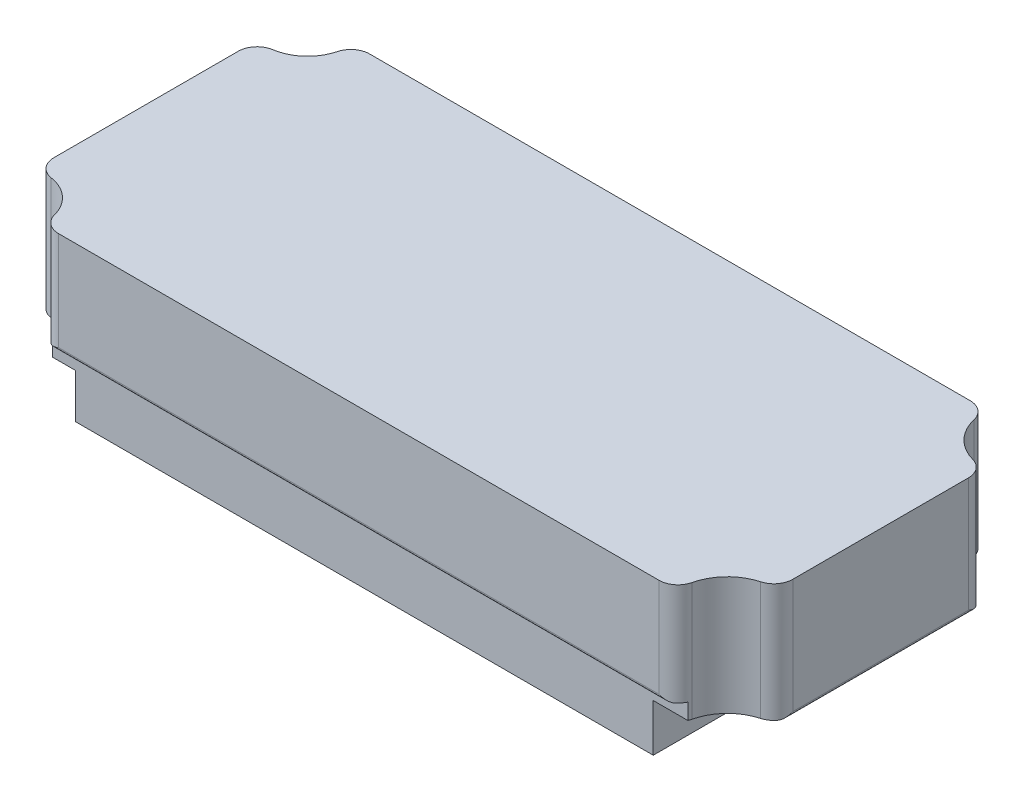
from build123d import *
from OCP.BRepAlgoAPI import BRepAlgoAPI_Cut
from OCP.TopTools import TopTools_ListOfShape

# Parameters (mm, degrees)
BOSS_EXTRUDE1_DEPTH     = 21.85
CUT_EXTRUDE1_DEPTH      = 48.4
CUT_EXTRUDE1_DEPTH_BACK = 48.4
CUT_EXTRUDE2_DEPTH      = 20.5
CUT_EXTRUDE2_DEPTH_BACK = 20.5


with BuildPart() as part:
    # Sketch1 → Boss-Extrude1 (new body)
    with BuildSketch(Plane(origin=(0, 0, 0), x_dir=(1, 0, 0), z_dir=(0, 1, 0))):
        with BuildLine():
            Line((-48.4, 12.151203914), (-48.4, -12.151203914))
            ThreePointArc((-48.4, -12.151203914), (-47.79906628, -13.773402604), (-46.286322418, -14.612602183))
            ThreePointArc((-46.286322418, -14.612602183), (-43.456956945, -15.955525197), (-41.833947517, -18.63406801))
            ThreePointArc((-41.833947517, -18.63406801), (-40.94758788, -19.979013629), (-39.423420787, -20.5))
            Line((-39.423420787, -20.5), (39.709565228, -20.5))
            ThreePointArc((39.709565228, -20.5), (41.256886583, -19.960870735), (42.134162778, -18.57694508))
            ThreePointArc((42.134162778, -18.57694508), (43.717900388, -15.664841516), (46.568112128, -13.972250299))
            ThreePointArc((46.568112128, -13.972250299), (47.889747358, -13.080993613), (48.4, -11.570794818))
            Line((48.4, -11.570794818), (48.4, 11.570794818))
            ThreePointArc((48.4, 11.570794818), (47.889747358, 13.080993613), (46.568112128, 13.972250299))
            ThreePointArc((46.568112128, 13.972250299), (43.717900388, 15.664841516), (42.134162778, 18.57694508))
            ThreePointArc((42.134162778, 18.57694508), (41.256886583, 19.960870735), (39.709565228, 20.5))
            Line((39.709565228, 20.5), (-39.423420787, 20.5))
            ThreePointArc((-39.423420787, 20.5), (-40.94758788, 19.979013629), (-41.833947517, 18.63406801))
            ThreePointArc((-41.833947517, 18.63406801), (-43.456956895, 15.955525241), (-46.286322286, 14.612602203))
            ThreePointArc((-46.286322286, 14.612602203), (-47.799066237, 13.773402654), (-48.4, 12.151203914))
        make_face()
    extrude(amount=BOSS_EXTRUDE1_DEPTH)

    # Sketch2 → Cut-Extrude1 (cut, two sides: drawn at the far end of the back side and taken through both)
    with BuildSketch(Plane(origin=(0, 0, 0), x_dir=(0, 0, -1), z_dir=(1, 0, 0)).offset(-CUT_EXTRUDE1_DEPTH_BACK)):
        with BuildLine():
            Line((-20.5, 8.85), (-20.5, 0))
            Line((-20.5, 0), (-19, 0))
            Line((-19, 0), (-19, 8.35))
            Line((-19, 8.35), (-20, 8.35))
            ThreePointArc((-20, 8.35), (-20.353553391, 8.496446609), (-20.5, 8.85))
        make_face()
    extrude(amount=CUT_EXTRUDE1_DEPTH + CUT_EXTRUDE1_DEPTH_BACK, mode=Mode.SUBTRACT)


with BuildPart() as cut_extrude2_tool:
    # Sketch3 → Cut-Extrude2 (new, two sides: drawn at the far end of the back side and taken through both)
    with BuildSketch(Plane.XY.offset(-CUT_EXTRUDE2_DEPTH_BACK)):
        with BuildLine():
            Line((-48.4, -5), (48.4, -5))
            Line((48.4, -5), (48.4, 6.75))
            ThreePointArc((48.4, 6.75), (48.253553391, 6.396446609), (47.9, 6.25))
            Line((47.9, 6.25), (37.44, 6.25))
            Line((37.44, 6.25), (37.44, 0))
            Line((37.44, 0), (-38.7, 0))
            Line((-38.7, 0), (-38.7, 5.85))
            Line((-38.7, 5.85), (-47.9, 5.85))
            ThreePointArc((-47.9, 5.85), (-48.253553391, 5.996446609), (-48.4, 6.35))
            Line((-48.4, 6.35), (-48.4, -5))
        make_face()
    extrude(amount=CUT_EXTRUDE2_DEPTH + CUT_EXTRUDE2_DEPTH_BACK)


with BuildPart() as part_1:
    add(part.part)

    # Cut-Extrude2: cut by cut_extrude2_tool, with a tolerance
    cut_extrude2_stock = TopTools_ListOfShape()
    cut_extrude2_stock.Append(part_1.part.wrapped)
    cut_extrude2_tools = TopTools_ListOfShape()
    cut_extrude2_tools.Append(cut_extrude2_tool.part.wrapped)
    cut_extrude2_cut = BRepAlgoAPI_Cut()
    cut_extrude2_cut.SetArguments(cut_extrude2_stock)
    cut_extrude2_cut.SetTools(cut_extrude2_tools)
    cut_extrude2_cut.SetFuzzyValue(0.00001)
    cut_extrude2_cut.Build()
    add(Compound.cast(cut_extrude2_cut.Shape()).solids(), mode=Mode.REPLACE)


solid = part_1.part
